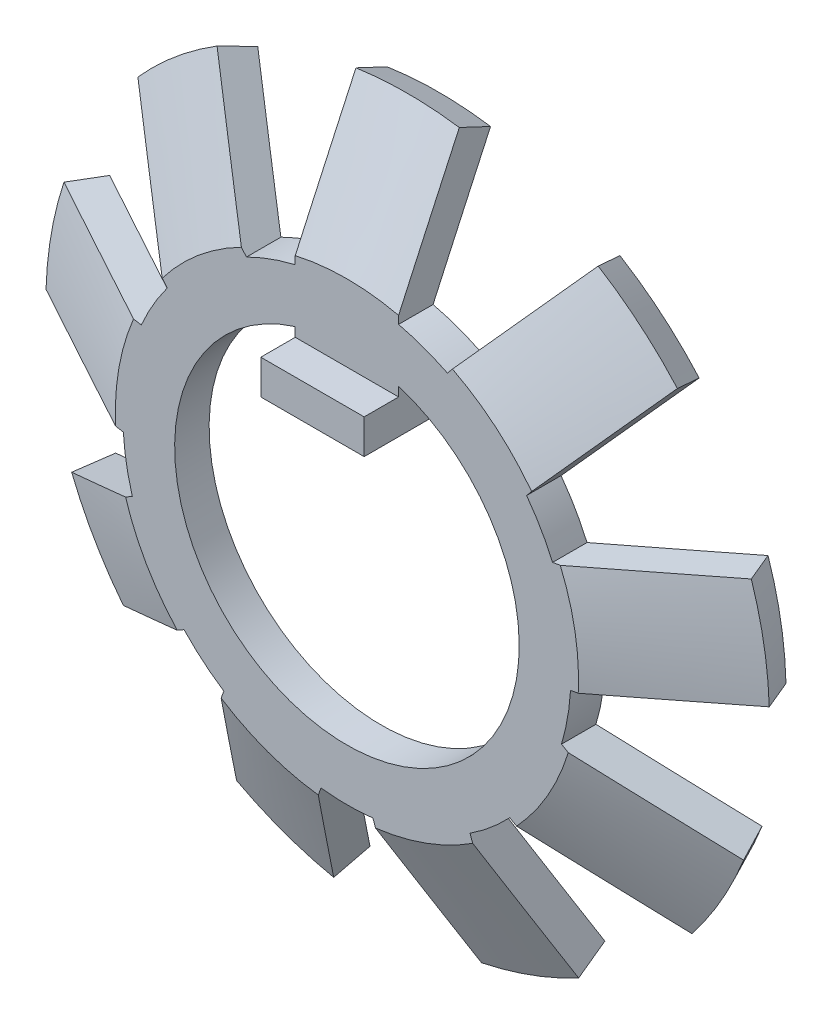
from build123d import *

# Parameters (mm, degrees)
CUT_EXTRUDE1_DEPTH  = 15.942649011
CIRPATTERN1_COUNT   = 9
BOSS_EXTRUDE1_DEPTH = 1.5


with BuildPart() as part:
    # Sketch1 → Revolve1 (revolve)
    with BuildSketch(Plane(origin=(0, 0, 0), x_dir=(0, 0, -1), z_dir=(1, 0, 0))):
        Polygon((0.761852714, 10.5), (-1, 6.721694663), (-1, 5), (0, 5), (0, 6.5), (1.668160501, 10.077381738), align=None)
    revolve(axis=Axis((0, 0, 0), (0, 0, 1)))

    # Sketch2 → Cut-Extrude1 (cut, symmetric)
    with BuildSketch(Plane.XY):
        with BuildLine():
            Line((1.5, 10.392304845), (1.5, 6.32455532))
            ThreePointArc((1.5, 6.32455532), (2.223130932, 6.108002035), (2.916279132, 5.809071873))
            Line((2.916279132, 5.809071873), (5.530978126, 8.925148793))
            ThreePointArc((5.530978126, 8.925148793), (3.591211505, 9.866772518), (1.5, 10.392304845))
        make_face()
    cut_extrude1 = extrude(amount=CUT_EXTRUDE1_DEPTH, both=True, mode=Mode.SUBTRACT)

    # CirPattern1: Cut-Extrude1 ×9 about axis
    cirpattern1_axis = Axis((0, 0, -1.801568526), (0, 0, 1))
    for i in range(1, CIRPATTERN1_COUNT):
        add(cut_extrude1.rotate(cirpattern1_axis, i * 360 / CIRPATTERN1_COUNT), mode=Mode.SUBTRACT)

    # Sketch3 → Boss-Extrude1 (add, symmetric)
    with BuildSketch(Plane(origin=(0, 0, 0), x_dir=(0, 0, -1), z_dir=(1, 0, 0))):
        Polygon((-2, 4.5), (-1, 4.5), (-1, 5), (0, 5), (0, 3.5), (-2, 3.5), align=None)
    extrude(amount=BOSS_EXTRUDE1_DEPTH, both=True)


solid = part.part
